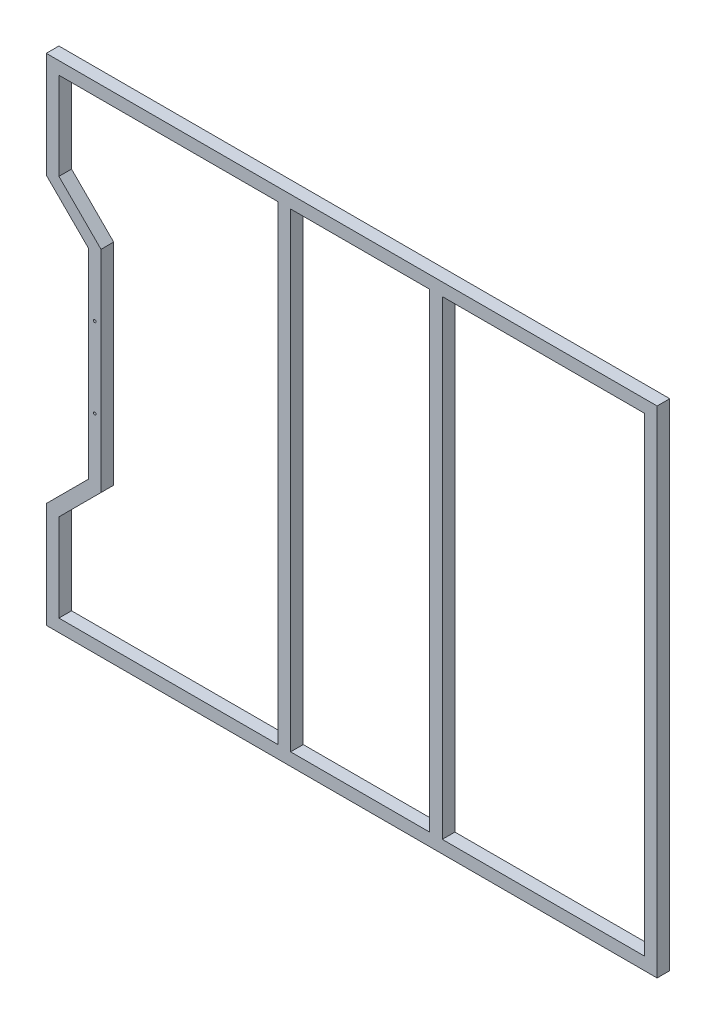
from build123d import *

# Parameters (mm, degrees)
EXTRUDE_1_DEPTH     = 15
SKETCH_3_R          = 1.6
CUT_EXTRUDE_1_DEPTH = 15


with BuildPart() as part:
    # 草图2 → 凸台-拉伸1 (new body)
    with BuildSketch(Plane.XY.offset(324)):
        Polygon((-362.700177837, 294), (-372.700177837, 294), (-372.700177837, 184.842706176), (-372.700177837, 168.786796564), (-322.700177837, 118.786796564), (-322.700177837, 55), (-322.700177837, 40.009301689), (-322.700177837, -40.009301689), (-322.700177837, -55), (-322.700177837, -118.786796564), (-372.700177837, -168.786796564), (-372.700177837, -184.842706176), (-372.700177837, -294), (132.5, -294), (147.5, -294), (344.325085215, -294), (352.325085215, -294), (352.325085215, -55), (352.325085215, -40), (352.325085215, 40), (352.325085215, 55), (352.325085215, 294), (346.200177837, 294), (147.5, 294), (132.5, 294), (-132.5, 294), (-147.5, 294), align=None)
        Polygon((-307.700177837, 40), (-307.700177837, 55), (-307.700177837, 105), (-307.700177837, 125), (-357.700177837, 175), (-357.700177837, 279), (-97.700177837, 279), (-97.700177837, 54.959605847), (-97.700177837, 39.959605847), (-97.700177837, 23.987767822), (-97.700177837, -40.040394153), (-97.700177837, -279.040394153), (-357.700177837, -279.040394153), (-357.700177837, -175), (-307.700177837, -125), (-307.700177837, -105), (-307.700177837, -55), (-307.700177837, -40), align=None, mode=Mode.SUBTRACT)
        Polygon((82.325085215, 279), (82.325085215, 55), (82.325085215, 40), (82.325085215, -40), (82.325085215, -55.040394153), (82.325085215, -279.040394153), (-82.700177837, -279.040394153), (-82.700177837, -55.040394153), (-82.700177837, -40.040394153), (-82.700177837, 39.959605847), (-82.700177837, 54.959605847), (-82.700177837, 279), align=None, mode=Mode.SUBTRACT)
        Polygon((337.325085215, 279), (337.325085215, 55), (337.325085215, 40), (337.325085215, -40), (337.325085215, -55), (337.325085215, -279), (97.325085215, -279), (97.325085215, -55), (97.325085215, -40), (97.325085215, 40), (97.325085215, 55), (97.325085215, 279), align=None, mode=Mode.SUBTRACT)
    extrude(amount=EXTRUDE_1_DEPTH)

    # 草图3 → 切除-拉伸1 (cut)
    with BuildSketch(Plane.XY.offset(339)):
        with Locations((-315.200177837, 47.5)):
            Circle(SKETCH_3_R)
        with Locations((-315.200177837, -47.5)):
            Circle(SKETCH_3_R)
    extrude(amount=-CUT_EXTRUDE_1_DEPTH, mode=Mode.SUBTRACT)


solid = part.part
